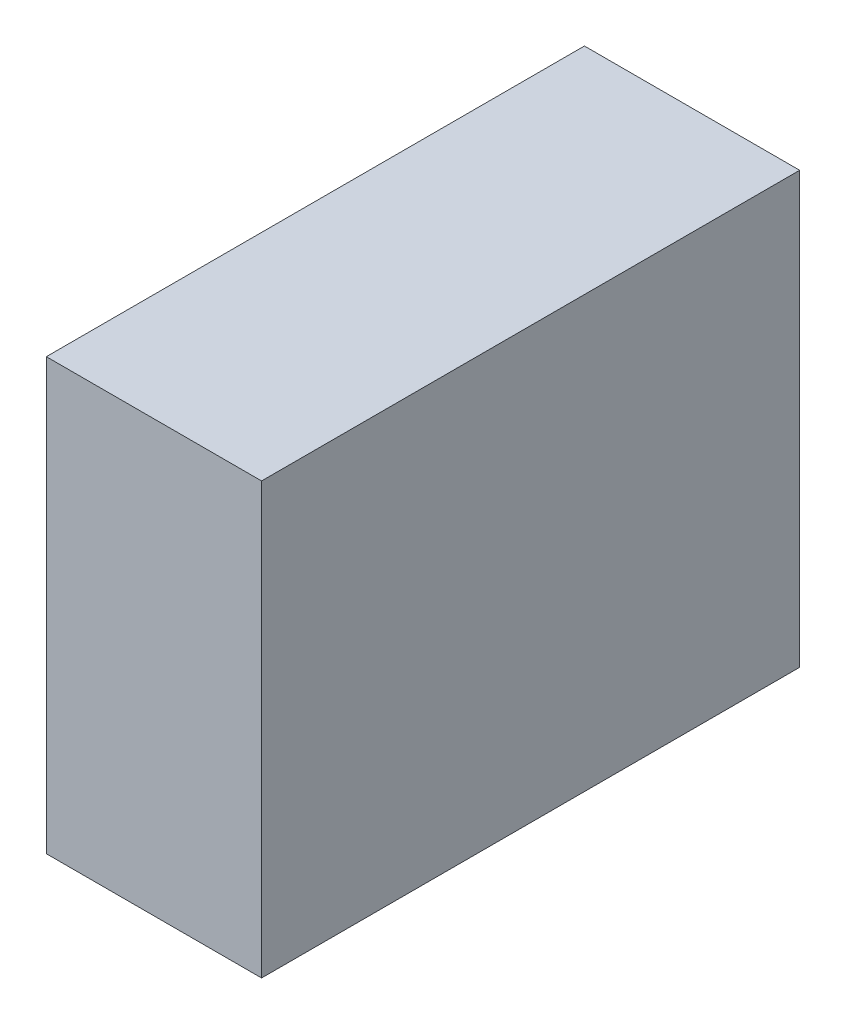
from build123d import *

# Parameters (mm, degrees)
SKETCH1_W           = 38.1
SKETCH1_H           = 76.2
BOSS_EXTRUDE1_DEPTH = 95.25


with BuildPart() as part:
    # Sketch1 → Boss-Extrude1 (new body)
    with BuildSketch(Plane.XY):
        with Locations((19.05, 38.1)):
            Rectangle(SKETCH1_W, SKETCH1_H)
    extrude(amount=BOSS_EXTRUDE1_DEPTH)


solid = part.part
